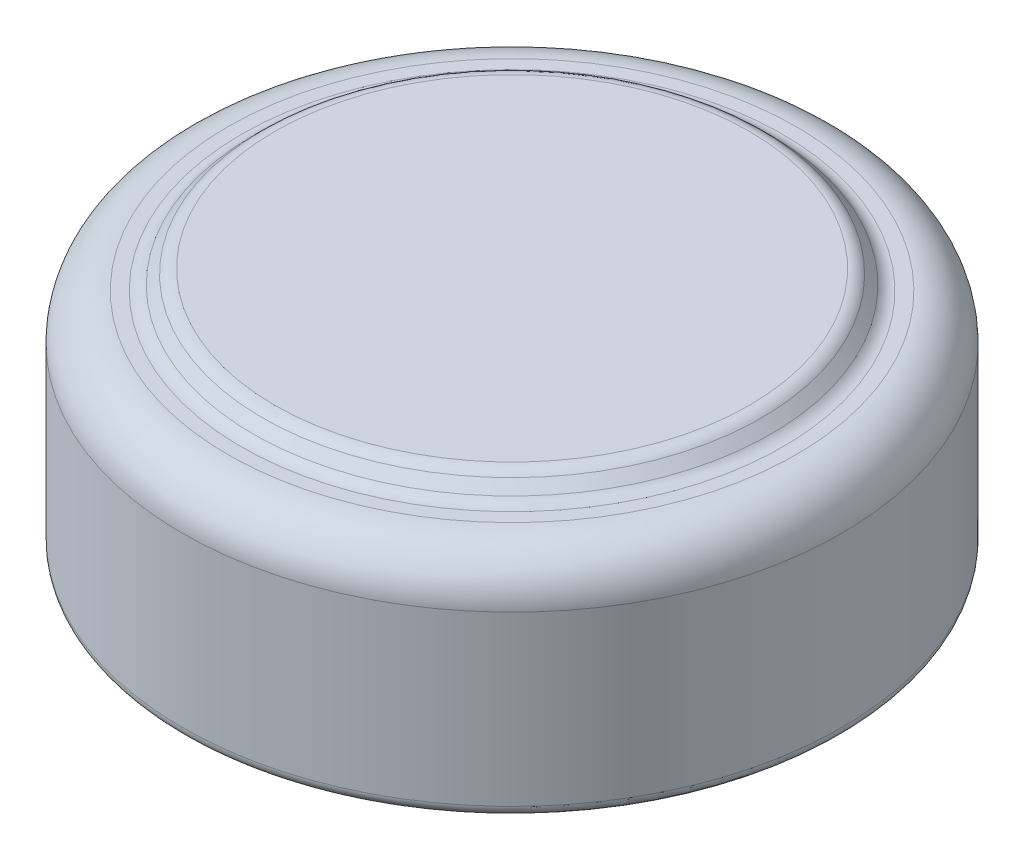
from build123d import *


with BuildPart() as part:
    # Sketch1 → Revolve1 (revolve)
    with BuildSketch(Plane.XY):
        with BuildLine():
            Line((0, 0), (-2.8, 0))
            ThreePointArc((-2.8, 0), (-2.870710678, 0.029289322), (-2.9, 0.1))
            Line((-2.9, 0.1), (-2.9, 1.58))
            ThreePointArc((-2.9, 1.58), (-2.782842712, 1.862842712), (-2.5, 1.98))
            Line((-2.5, 1.98), (-2.382132034, 1.98))
            ThreePointArc((-2.382132034, 1.98), (-2.32472952, 1.99141807), (-2.276066017, 2.023933983))
            Line((-2.276066017, 2.023933983), (-2.193933983, 2.106066017))
            ThreePointArc((-2.193933983, 2.106066017), (-2.14527048, 2.13858193), (-2.087867966, 2.15))
            Line((-2.087867966, 2.15), (0, 2.15))
            Line((0, 2.15), (0, 0))
        make_face()
    revolve(axis=Axis((0, 2.15, 0), (0, -1, 0)))


solid = part.part
